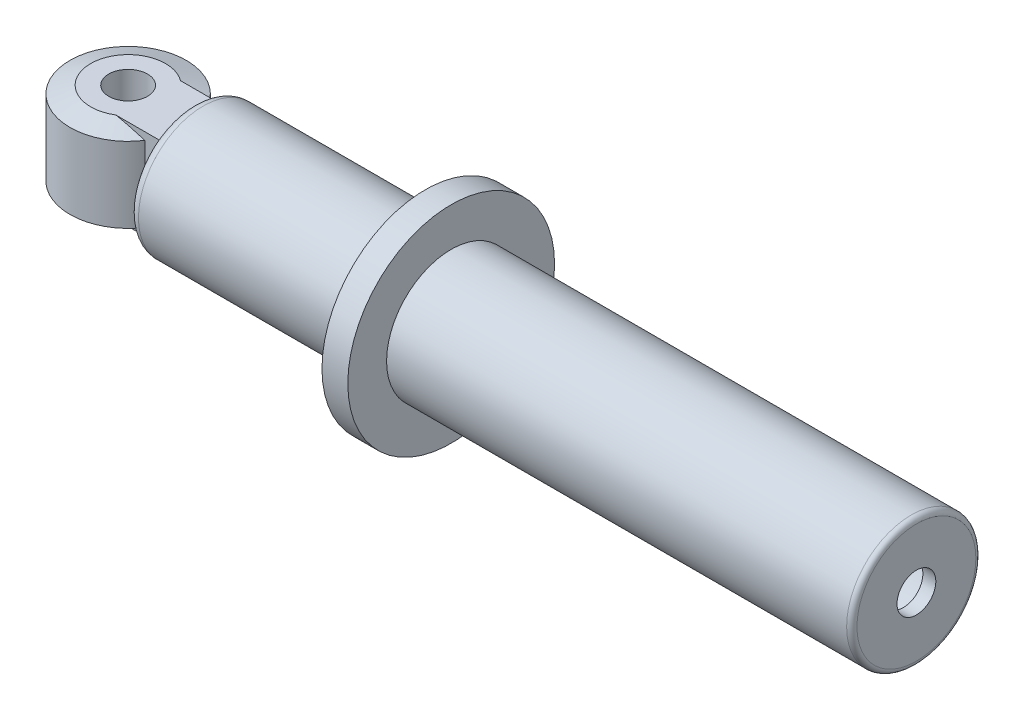
from build123d import *
from OCP.BRepFilletAPI import BRepFilletAPI_MakeChamfer

# Parameters (mm, degrees)
SKETCH2_R           = 4.7625
BOSS_EXTRUDE1_DEPTH = 11.1125
FILLET1_R           = 2.54
CHAMFER1_SIZE       = 5.08
CHAMFER1_SIZE2      = 1.84896879
FILLET2_R           = 1.27


with BuildPart() as part:
    # Sketch1 → Revolve1 (revolve)
    with BuildSketch(Plane(origin=(0, 0, 0), x_dir=(1, 0, 0), z_dir=(0, 1, 0)), mode=Mode.PRIVATE) as revolve1_sk:
        Polygon((-96.197401359, 18.174240066), (-96.197401359, 2.299240066), (2.227598641, 2.299240066), (2.227598641, 14.999240066), (78.427598641, 14.999240066), (78.427598641, 7.061740066), (81.602598641, 7.061740066), (81.602598641, 18.174240066), (-32.697401359, 18.174240066), (-32.697401359, 27.699240066), (-39.047401359, 27.699240066), (-39.047401359, 18.174240066), align=None)
    revolve(revolve1_sk.sketch.rotate(Axis((-96.197401359, 0, -2.299240066), (1, 0, 0)), 180), axis=Axis((-96.197401359, 0, -2.299240066), (1, 0, 0)))

    # Sketch2 → Boss-Extrude1 (add, symmetric)
    with BuildSketch(Plane(origin=(0, 0, 0), x_dir=(1, 0, 0), z_dir=(0, 1, 0))):
        with BuildLine():
            Line((-99.846730597, 9.692861011), (-96.197401359, 9.692861011))
            Line((-96.197401359, 9.692861011), (-96.197401359, -5.547138989))
            Line((-96.197401359, -5.547138989), (-100.132259318, -5.547138989))
            ThreePointArc((-100.132259318, -5.547138989), (-126.357394433, 2.566876274), (-99.846730597, 9.692861011))
        make_face()
        with Locations(Location((-112.072401359, 2.299240066, 0), (0, 0, 270))):
            Circle(SKETCH2_R, mode=Mode.SUBTRACT)
    extrude(amount=BOSS_EXTRUDE1_DEPTH, both=True)

    # Fillet1
    # the kernel refuses this fillet: 2.54 mm, written as the material it takes off along each edge
    with BuildSketch(Plane(origin=(-96.197401359, 0, -2.299240066), x_dir=(0, 0, 1), z_dir=(0, 1, 0))) as fillet1_piece_1_section:
        with BuildLine():
            CenterArc((15.875 - FILLET1_R, FILLET1_R), FILLET1_R, 270, 90)
            Line((15.875, FILLET1_R), (15.875, 0))
            Line((15.875, 0), (15.875 - FILLET1_R, 0))
        make_face()
    fillet1_piece_1 = revolve(axis=Axis((-96.197401359, 0, -2.299240066), (1, 0, 0)), mode=Mode.PRIVATE)
    fillet1_piece_1 = split(fillet1_piece_1, bisect_by=Plane(origin=(-95.476463438, -6.970916777, 5.547138989), z_dir=(0, 0, 1)), keep=Keep.TOP, mode=Mode.PRIVATE)
    add(fillet1_piece_1, mode=Mode.SUBTRACT)
    with BuildSketch(Plane(origin=(-96.197401359, 0, -2.299240066), x_dir=(0, 0, 1), z_dir=(0, 1, 0))) as fillet1_piece_2_section:
        with BuildLine():
            CenterArc((15.875 - FILLET1_R, FILLET1_R), FILLET1_R, 270, 90)
            Line((15.875, FILLET1_R), (15.875, 0))
            Line((15.875, 0), (15.875 - FILLET1_R, 0))
        make_face()
    fillet1_piece_2 = revolve(axis=Axis((-96.197401359, 0, -2.299240066), (1, 0, 0)), mode=Mode.PRIVATE)
    fillet1_piece_2 = split(fillet1_piece_2, bisect_by=Plane(origin=(-95.473294042, -11.1125, -2.089306166), z_dir=(0, -1, 0)), keep=Keep.TOP, mode=Mode.PRIVATE)
    add(fillet1_piece_2, mode=Mode.SUBTRACT)
    with BuildSketch(Plane(origin=(-96.197401359, 0, -2.299240066), x_dir=(0, 0, 1), z_dir=(0, 1, 0))) as fillet1_piece_3_section:
        with BuildLine():
            CenterArc((15.875 - FILLET1_R, FILLET1_R), FILLET1_R, 270, 90)
            Line((15.875, FILLET1_R), (15.875, 0))
            Line((15.875, 0), (15.875 - FILLET1_R, 0))
        make_face()
    fillet1_piece_3 = revolve(axis=Axis((-96.197401359, 0, -2.299240066), (1, 0, 0)), mode=Mode.PRIVATE)
    fillet1_piece_3 = split(fillet1_piece_3, bisect_by=Plane(origin=(-95.473294037, 11.1125, -2.089306166), z_dir=(0, 1, 0)), keep=Keep.TOP, mode=Mode.PRIVATE)
    add(fillet1_piece_3, mode=Mode.SUBTRACT)
    with BuildSketch(Plane(origin=(-96.197401359, 0, -2.299240066), x_dir=(0, 0, 1), z_dir=(0, 1, 0))) as fillet1_piece_4_section:
        with BuildLine():
            CenterArc((15.875 - FILLET1_R, FILLET1_R), FILLET1_R, 270, 90)
            Line((15.875, FILLET1_R), (15.875, 0))
            Line((15.875, 0), (15.875 - FILLET1_R, 0))
        make_face()
    fillet1_piece_4 = revolve(axis=Axis((-96.197401359, 0, -2.299240066), (1, 0, 0)), mode=Mode.PRIVATE)
    fillet1_piece_4 = split(fillet1_piece_4, bisect_by=Plane(origin=(-95.47646351, 0, -9.692861011), z_dir=(0, 0, -1)), keep=Keep.TOP, mode=Mode.PRIVATE)
    add(fillet1_piece_4, mode=Mode.SUBTRACT)

    # Chamfer1: one chamfer whose edges measure the first distance from different faces: ONE call of the kernel's chamfer builder (chamfer() names one face for all edges)
    chamfer1_edges_1 = [part.edges().sort_by_distance(p)[0] for p in [
        (-126.357394433, 11.1125, -2.566876274),
    ]]
    chamfer1_side_1 = [part.faces().sort_by_distance(p)[0] for p in [
        (-125.941875569, 11.1125, -2.559091328),
    ]]
    chamfer1_edges_2 = [part.edges().sort_by_distance(p)[0] for p in [
        (-126.357394433, -11.1125, -2.566876274),
    ]]
    chamfer1_side_2 = [part.faces().sort_by_distance(p)[0] for p in [
        (-125.941875569, -11.1125, -2.559091328),
    ]]
    chamfer1 = BRepFilletAPI_MakeChamfer(part.part.solid().wrapped)
    for e in chamfer1_edges_1:
        chamfer1.Add(CHAMFER1_SIZE, CHAMFER1_SIZE2, e.wrapped, chamfer1_side_1[0].wrapped)  # the first distance lies on this face
    for e in chamfer1_edges_2:
        chamfer1.Add(CHAMFER1_SIZE, CHAMFER1_SIZE2, e.wrapped, chamfer1_side_2[0].wrapped)  # the first distance lies on this face
    add(Compound.cast(chamfer1.Shape()), mode=Mode.REPLACE)

    # Fillet2
    fillet2_edges = [part.edges().sort_by_distance(p)[0] for p in [
        (81.602598641, 0, -18.174240066),
    ]]
    fillet(fillet2_edges, radius=FILLET2_R)


solid = part.part
